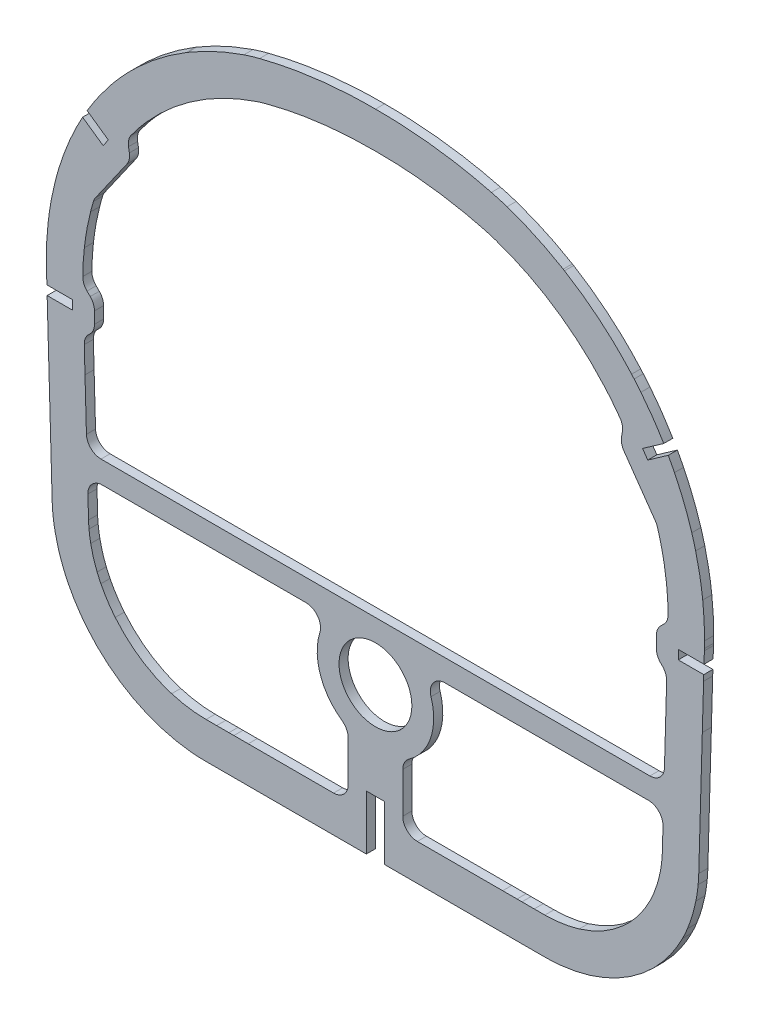
from build123d import *

# Parameters (mm, degrees)
SKETCH1_R           = 12.700000000000001
BOSS_EXTRUDE1_DEPTH = 1.5875
SKETCH2_R           = 20.320000000000004
CUT_EXTRUDE1_DEPTH  = 169.34386796933504
BOSS_EXTRUDE2_START = -3.175
BOSS_EXTRUDE2_DEPTH = 3.175
CUT_EXTRUDE3_DEPTH  = 169.34386796933504
FILLET1_R           = 5.08


with BuildPart() as part:
    # Sketch1 → Boss-Extrude1 (new, symmetric)
    with BuildSketch(Plane.XY):
        with BuildLine():
            Line((-114.7452197006329, 17.502683519570404), (-114.72594109896555, 16.83199064857102))
            add(Edge.make_bspline(
                [(-114.72594109896555, 16.83199064857102), (-114.63641058990241, 13.717126836218588), (-114.54692036583873, 10.602259401409691), (-114.45747777614487, 7.487385264694304)],
                knots=[0, 0, 0, 0, 1, 1, 1, 1], degree=3, weights=[1, 1, 1, 1]))
            add(Edge.make_bspline(
                [(-114.45747777614487, 7.487385264694304), (-114.30718797143473, 2.253479661651684), (-114.15700866213814, -2.980453956785725), (-114.00699685839271, -8.214429233663035)],
                knots=[0, 0, 0, 0, 1, 1, 1, 1], degree=3, weights=[1, 1, 1, 1]))
            add(Edge.make_bspline(
                [(-114.00699685839271, -8.214429233663035), (-113.594092007642, -22.620853681126103), (-113.18138690950695, -37.02768380672695), (-112.76874515326054, -51.434848977248656)],
                knots=[0, 0, 0, 0, 1, 1, 1, 1], degree=3, weights=[1, 1, 1, 1]))
            ThreePointArc((-112.76874515326054, -51.434848977248656), (-112.68804333866615, -53.1759331373922), (-112.55087678962421, -54.91348088447918))
            ThreePointArc((-112.55087678962421, -54.91348088447918), (-112.22797864595222, -57.58878393541259), (-111.77128477130692, -60.244521183405745))
            add(Edge.make_bspline(
                [(-111.77128477130692, -60.244521183405745), (-111.1073733148537, -63.598835081976574), (-110.12206449281399, -66.88944897002129), (-108.83322390889208, -70.0566544796016)],
                knots=[0, 0, 0, 0, 1, 1, 1, 1], degree=3, weights=[1, 1, 1, 1]))
            ThreePointArc((-108.83322390889208, -70.0566544796016), (-108.01356493798, -71.96435471079279), (-107.12076116778223, -73.83893797877646))
            add(Edge.make_bspline(
                [(-107.12076116778223, -73.83893797877646), (-105.32883254477298, -77.42121554975256), (-103.13441882445123, -80.80203517755982), (-100.59192102351365, -83.8972820272281)],
                knots=[0, 0, 0, 0, 1, 1, 1, 1], degree=3, weights=[1, 1, 1, 1]))
            add(Edge.make_bspline(
                [(-100.59192102351365, -83.8972820272281), (-95.59242527238186, -89.98368785895089), (-89.40102010512265, -95.0940325478926), (-82.31665423774274, -98.86998494857941), (-74.78459324955335, -101.17197690928097)],
                knots=[0, 0, 0, 0, 0, 1, 1, 1, 1, 1], degree=4, weights=[1, 1, 1, 1, 1]))
            add(Edge.make_bspline(
                [(-74.78459324955335, -101.17197690928097), (-69.70375314313806, -102.72481259724978), (-64.39158382619704, -103.51812327161942), (-59.07890091428872, -103.51750007032157)],
                knots=[0, 0, 0, 0, 1, 1, 1, 1], degree=3, weights=[1, 1, 1, 1]))
            add(Edge.make_bspline(
                [(-59.07890091428872, -103.51750007032157), (-57.846433259477166, -103.51735549787801), (-56.61397530630568, -103.51723826558838), (-55.38152448537701, -103.517145846477)],
                knots=[0, 0, 0, 0, 1, 1, 1, 1], degree=3, weights=[1, 1, 1, 1]))
            add(Edge.make_bspline(
                [(-55.38152448537701, -103.517145846477), (-53.95716671470069, -103.51703903855777), (-52.53281923226491, -103.51696799755912), (-51.10847777162478, -103.5169356729528)],
                knots=[0, 0, 0, 0, 1, 1, 1, 1], degree=3, weights=[1, 1, 1, 1]))
            Line((-51.10847777162478, -103.5169356729528), (-49.37860046686426, -103.51691546671823))
            add(Edge.make_bspline(
                [(-49.37860046686426, -103.51691546671823), (-47.71016069532774, -103.5169146296126), (-46.04172764724473, -103.51696183124892), (-44.37329370146884, -103.51707762925778)],
                knots=[0, 0, 0, 0, 1, 1, 1, 1], degree=3, weights=[1, 1, 1, 1]))
            add(Edge.make_bspline(
                [(-44.37329370146884, -103.51707762925778), (-29.582422277033825, -103.51810415951752), (-14.791380965373275, -103.51962644471186), (-1.5811525e-09, -103.52167238588633)],
                knots=[0, 0, 0, 0, 1, 1, 1, 1], degree=3, weights=[1, 1, 1, 1]))
            add(Edge.make_bspline(
                [(44.37329370146884, -103.51707762925778), (29.582422277033825, -103.51810415951752), (14.791380965373275, -103.51962644471186), (-1.5811525e-09, -103.52167238588633)],
                knots=[0, 0, 0, 0, 1, 1, 1, 1], degree=3, weights=[1, 1, 1, 1]))
            add(Edge.make_bspline(
                [(49.37860046686426, -103.51691546671823), (47.71016069532774, -103.5169146296126), (46.04172764724473, -103.51696183124892), (44.37329370146884, -103.51707762925778)],
                knots=[0, 0, 0, 0, 1, 1, 1, 1], degree=3, weights=[1, 1, 1, 1]))
            Line((49.37860046686426, -103.51691546671823), (51.10847777162478, -103.5169356729528))
            add(Edge.make_bspline(
                [(55.38152448537701, -103.517145846477), (53.95716671470069, -103.51703903855777), (52.53281923226491, -103.51696799755912), (51.10847777162478, -103.5169356729528)],
                knots=[0, 0, 0, 0, 1, 1, 1, 1], degree=3, weights=[1, 1, 1, 1]))
            add(Edge.make_bspline(
                [(59.07890091428872, -103.51750007032157), (57.846433259477166, -103.51735549787801), (56.61397530630568, -103.51723826558838), (55.38152448537701, -103.517145846477)],
                knots=[0, 0, 0, 0, 1, 1, 1, 1], degree=3, weights=[1, 1, 1, 1]))
            add(Edge.make_bspline(
                [(74.78459324955335, -101.17197690928097), (69.70375314313806, -102.72481259724978), (64.39158382619704, -103.51812327161942), (59.07890091428872, -103.51750007032157)],
                knots=[0, 0, 0, 0, 1, 1, 1, 1], degree=3, weights=[1, 1, 1, 1]))
            add(Edge.make_bspline(
                [(100.59192102351365, -83.8972820272281), (95.59242527238186, -89.98368785895089), (89.40102010512265, -95.0940325478926), (82.31665423774274, -98.86998494857941), (74.78459324955335, -101.17197690928097)],
                knots=[0, 0, 0, 0, 0, 1, 1, 1, 1, 1], degree=4, weights=[1, 1, 1, 1, 1]))
            add(Edge.make_bspline(
                [(107.12076116778223, -73.83893797877646), (105.32883254477298, -77.42121554975256), (103.13441882445123, -80.80203517755982), (100.59192102351365, -83.8972820272281)],
                knots=[0, 0, 0, 0, 1, 1, 1, 1], degree=3, weights=[1, 1, 1, 1]))
            ThreePointArc((107.12076116778223, -73.83893797877646), (108.01356493798, -71.9643547107928), (108.83322390889208, -70.0566544796016))
            add(Edge.make_bspline(
                [(111.77128477130692, -60.244521183405745), (111.1073733148537, -63.598835081976574), (110.12206449281399, -66.88944897002129), (108.83322390889208, -70.0566544796016)],
                knots=[0, 0, 0, 0, 1, 1, 1, 1], degree=3, weights=[1, 1, 1, 1]))
            ThreePointArc((111.77128477130692, -60.244521183405745), (112.22797864595222, -57.58878393541259), (112.55087678962421, -54.91348088447918))
            ThreePointArc((112.55087678962421, -54.91348088447918), (112.68804333866615, -53.17593313739219), (112.76874515326054, -51.434848977248656))
            add(Edge.make_bspline(
                [(114.00699685839271, -8.214429233663035), (113.594092007642, -22.620853681126103), (113.18138690950695, -37.02768380672695), (112.76874515326054, -51.434848977248656)],
                knots=[0, 0, 0, 0, 1, 1, 1, 1], degree=3, weights=[1, 1, 1, 1]))
            add(Edge.make_bspline(
                [(114.45747777614487, 7.487385264694304), (114.30718797143473, 2.253479661651684), (114.15700866213814, -2.980453956785725), (114.00699685839271, -8.214429233663035)],
                knots=[0, 0, 0, 0, 1, 1, 1, 1], degree=3, weights=[1, 1, 1, 1]))
            add(Edge.make_bspline(
                [(114.72594109896555, 16.83199064857102), (114.63641058990241, 13.717126836218588), (114.54692036583873, 10.602259401409691), (114.45747777614487, 7.487385264694304)],
                knots=[0, 0, 0, 0, 1, 1, 1, 1], degree=3, weights=[1, 1, 1, 1]))
            Line((114.72594109896555, 16.83199064857102), (114.7452197006329, 17.502683519570404))
            add(Edge.make_bspline(
                [(114.7890059115134, 19.863219176694063), (114.7835780692486, 19.076239431927775), (114.76783208153577, 18.289356898186814), (114.7452197006329, 17.502683519570404)],
                knots=[0, 0, 0, 0, 0.9999498505076996, 0.9999498505076996, 0.9999498505076996, 0.9999498505076996], degree=3, weights=[1, 1, 1, 1]))
            add(Edge.make_bspline(
                [(114.15894327556961, 31.865695052286362), (114.60613845908075, 27.882027971749473), (114.81665344143374, 23.871808144028062), (114.7890059115134, 19.863219176694063)],
                knots=[0, 0, 0, 0, 1, 1, 1, 1], degree=3, weights=[1, 1, 1, 1]))
            add(Edge.make_bspline(
                [(111.684573502519, 45.4610336377593), (112.81734049393746, 40.992572366905875), (113.64469045396903, 36.44671950470451), (114.15894327556961, 31.865695052286362)],
                knots=[0, 0, 0, 0, 1, 1, 1, 1], degree=3, weights=[1, 1, 1, 1]))
            ThreePointArc((111.684573502519, 45.4610336377593), (111.03906135213371, 47.88139437458557), (110.3339195986165, 50.28505972985278))
            add(Edge.make_bspline(
                [(104.30641025218718, 65.4477511057322), (106.71886285229947, 60.56649996133052), (108.73674389160301, 55.49036874894405), (110.3339195986165, 50.28505972985278)],
                knots=[0, 0, 0, 0, 1, 1, 1, 1], degree=3, weights=[1, 1, 1, 1]))
            add(Edge.make_bspline(
                [(92.59150342724206, 83.84885261225975), (97.14327095044497, 78.16017149746612), (101.07854504066823, 71.97887259239612), (104.30641025218718, 65.4477511057322)],
                knots=[0.00015516687657362, 0.00015516687657362, 0.00015516687657362, 0.00015516687657362, 1, 1, 1, 1], degree=3, weights=[1, 1, 1, 1]))
            ThreePointArc((92.59150342724206, 83.84885261225975), (91.42507816905498, 85.2796957156788), (90.23277102888983, 86.6890443428995))
            ThreePointArc((90.23277102888983, 86.6890443428995), (89.79223213194632, 87.19683786942522), (89.34833219659208, 87.70169590196916))
            add(Edge.make_bspline(
                [(65.94432999771517, 107.22681485913718), (74.66889148105416, 101.94541730184362), (82.58894175346335, 95.33803001789981), (89.34833219659208, 87.70169590196916)],
                knots=[0, 0, 0, 0, 1, 1, 1, 1], degree=3, weights=[1, 1, 1, 1]))
            Line((65.94432999771517, 107.22681485913718), (65.49624085564622, 107.49648616368657))
            add(Edge.make_bspline(
                [(45.895792552675076, 116.5445185858013), (52.726322535675486, 114.23712446443145), (59.3094251803046, 111.19813338148634), (65.49624085564622, 107.49648616368657)],
                knots=[0, 0, 0, 0, 1, 1, 1, 1], degree=3, weights=[1, 1, 1, 1]))
            ThreePointArc((45.895792552675076, 116.5445185858013), (43.17799654744927, 117.40316616219629), (40.42839902855836, 118.1537687671607))
            add(Edge.make_bspline(
                [(40.42839902855836, 118.1537687671607), (39.33806183749876, 118.42838758689368), (37.1574632082568, 118.97760614678802), (33.85630153491988, 119.7094898902904), (30.535885824062376, 120.37426223953587), (27.19582924530948, 120.96549094489052), (23.838631119796016, 121.48509536527982), (20.465916690485443, 121.93269365848225), (17.079460248796543, 122.30850094608213), (13.680927413418125, 122.6123574228248), (10.271955070812115, 122.84468791805438), (6.8541610765224625, 123.00360566536389), (3.429096591574733, 123.09552645722273), (1.143477199439534, 123.09552645720133), (-1.58115076e-09, 123.09552645719057)],
                knots=[0, 0, 0, 0, 0.08319982321872643, 0.16639386599995798, 0.24958922098778757, 0.3327940500648784, 0.41601744163079, 0.49926927384300424, 0.5825600915037497, 0.6659009868953494, 0.7493034844056105, 0.8327794289788419, 0.9163408784672036, 1, 1, 1, 1], degree=3))
            add(Edge.make_bspline(
                [(-40.42839902855836, 118.1537687671607), (-39.33806183758537, 118.42838758688279), (-37.157463208516646, 118.97760614675535), (-33.85630153544102, 119.7094898902324), (-30.535885824845685, 120.37426223945792), (-27.19582924635577, 120.96549094479849), (-23.838631121105937, 121.48509536517938), (-20.465916692059512, 121.93269365837907), (-17.079460250635144, 122.30850094598189), (-13.680927415521507, 122.61235742273314), (-10.27195507318041, 122.84468791797694), (-6.854161079155658, 123.00360566530641), (-3.4290965944727594, 123.09552645719042), (-1.1434772025137092, 123.09552645719056), (-1.58115076e-09, 123.09552645719057)],
                knots=[0, 0, 0, 0, 0.08319982321872643, 0.16639386599995798, 0.24958922098778757, 0.3327940500648784, 0.41601744163079, 0.49926927384300424, 0.5825600915037497, 0.6659009868953494, 0.7493034844056105, 0.8327794289788419, 0.9163408784672036, 1, 1, 1, 1], degree=3))
            ThreePointArc((-40.42839902855836, 118.1537687671607), (-43.17799654744926, 117.4031661621963), (-45.895792552675076, 116.5445185858013))
            add(Edge.make_bspline(
                [(-45.895792552675076, 116.5445185858013), (-52.726322535675486, 114.23712446443145), (-59.3094251803046, 111.19813338148634), (-65.49624085564622, 107.49648616368657)],
                knots=[0, 0, 0, 0, 1, 1, 1, 1], degree=3, weights=[1, 1, 1, 1]))
            Line((-65.49624085564622, 107.49648616368657), (-65.94432999771517, 107.22681485913718))
            add(Edge.make_bspline(
                [(-65.94432999771517, 107.22681485913718), (-74.66889148105416, 101.94541730184362), (-82.58894175346335, 95.33803001789981), (-89.34833219659208, 87.70169590196916)],
                knots=[0, 0, 0, 0, 1, 1, 1, 1], degree=3, weights=[1, 1, 1, 1]))
            ThreePointArc((-89.34833219659208, 87.70169590196916), (-89.79223213194632, 87.19683786942522), (-90.23277102888983, 86.6890443428995))
            ThreePointArc((-90.23277102888983, 86.6890443428995), (-91.42507816905497, 85.27969571567883), (-92.59150342724206, 83.84885261225975))
            add(Edge.make_bspline(
                [(-92.59150342724206, 83.84885261225975), (-97.14327095044497, 78.16017149746612), (-101.07854504066823, 71.97887259239612), (-104.30641025218718, 65.4477511057322)],
                knots=[0.00015516687657362, 0.00015516687657362, 0.00015516687657362, 0.00015516687657362, 1, 1, 1, 1], degree=3, weights=[1, 1, 1, 1]))
            add(Edge.make_bspline(
                [(-104.30641025218718, 65.4477511057322), (-106.71886285229947, 60.56649996133052), (-108.73674389160301, 55.49036874894405), (-110.3339195986165, 50.28505972985278)],
                knots=[0, 0, 0, 0, 1, 1, 1, 1], degree=3, weights=[1, 1, 1, 1]))
            ThreePointArc((-110.3339195986165, 50.28505972985278), (-111.03906135213371, 47.881394374585554), (-111.684573502519, 45.4610336377593))
            add(Edge.make_bspline(
                [(-111.684573502519, 45.4610336377593), (-112.81734049393746, 40.992572366905875), (-113.64469045396903, 36.44671950470451), (-114.15894327556961, 31.865695052286362)],
                knots=[0, 0, 0, 0, 1, 1, 1, 1], degree=3, weights=[1, 1, 1, 1]))
            add(Edge.make_bspline(
                [(-114.15894327556961, 31.865695052286362), (-114.60613845908075, 27.882027971749473), (-114.81665344143374, 23.871808144028062), (-114.7890059115134, 19.863219176694063)],
                knots=[0, 0, 0, 0, 1, 1, 1, 1], degree=3, weights=[1, 1, 1, 1]))
            add(Edge.make_bspline(
                [(-114.7890059115134, 19.863219176694063), (-114.7835780692486, 19.076239431927775), (-114.76783208153577, 18.289356898186814), (-114.7452197006329, 17.502683519570404)],
                knots=[0, 0, 0, 0, 0.9999498505076996, 0.9999498505076996, 0.9999498505076996, 0.9999498505076996], degree=3, weights=[1, 1, 1, 1]))
        make_face()
        with Locations((0, -50.8)):
            Circle(SKETCH1_R, mode=Mode.SUBTRACT)
    extrude(amount=BOSS_EXTRUDE1_DEPTH, both=True)

    # Sketch2 → Cut-Extrude1 (cut, through all)
    with BuildSketch(Plane.XY.offset(1.5875)):
        with BuildLine():
            Line((-102.05046304501089, 17.867585498929238), (-102.03118420379151, 17.19688429403577))
            add(Edge.make_bspline(
                [(-102.03118420379151, 17.19688429403577), (-102.00880074568765, 16.41813943518699), (-101.96403890957323, 14.860650807524046), (-101.89691177324582, 12.524410000891692), (-101.82980105137004, 10.18816478438498), (-101.78507189346547, 8.630662089436115), (-101.76271032129195, 7.851911350464416)],
                knots=[-8.9129106647e-07, -8.9129106647e-07, -8.9129106647e-07, -8.9129106647e-07, 0.24999933153170015, 0.49999955435446675, 0.7499997771772333, 1, 1, 1, 1], degree=3))
            add(Edge.make_bspline(
                [(-101.76271032129195, 7.851911350464416), (-101.72513644418133, 6.543385290985036), (-101.65000280099126, 3.926340070305929), (-101.53734822694257, 0.00072939642337794), (-101.42474548905955, -3.9249044925446195), (-101.34971468786911, -6.542025090419771), (-101.31220993120635, -7.850581912197028)],
                knots=[0, 0, 0, 0, 0.25, 0.5, 0.75, 1, 1, 1, 1], degree=3))
            add(Edge.make_bspline(
                [(-101.31220993120635, -7.850581912197028), (-101.20900572823022, -11.451420095940556), (-101.00262463643593, -18.6530649395015), (-100.69311365187139, -29.45572791211675), (-100.38365329188234, -40.25848396259931), (-100.17736995172882, -47.4604370312094), (-100.07423324793606, -51.0613993294313)],
                knots=[0, 0, 0, 0, 0.2499430109272707, 0.4998860218545414, 0.7498290327818121, 0.9997720437090828, 0.9997720437090828, 0.9997720437090828, 0.9997720437090828], degree=3))
            ThreePointArc((-100.07423324793606, -51.0613993294313), (-100.01261182717461, -52.38633841552202), (-99.90816190893503, -53.70859065920598))
            ThreePointArc((-99.90816190893503, -53.70859065920598), (-99.66163291628735, -55.75113462094698), (-99.31295711405238, -57.77874098432134))
            add(Edge.make_bspline(
                [(-99.31295711405238, -57.77874098432134), (-99.18629820756037, -58.41866084206956), (-98.90236460900753, -59.692255532014435), (-98.38522585746843, -61.58227401578457), (-97.77853202516384, -63.4454753308098), (-97.31578928202734, -64.66552433544275), (-97.0699125288233, -65.26974468553459)],
                knots=[8.43480030505e-06, 8.43480030505e-06, 8.43480030505e-06, 8.43480030505e-06, 0.2500054480585301, 0.5000024613167552, 0.7499994745749803, 0.9999964878332054, 0.9999964878332054, 0.9999964878332054, 0.9999964878332054], degree=3))
            ThreePointArc((-97.0699125288233, -65.26974468553459), (-96.44413848330768, -66.72618981171381), (-95.76252267250297, -68.15735208346123))
            add(Edge.make_bspline(
                [(-95.76252267250297, -68.15735208346123), (-95.42072188376622, -68.84065093508114), (-94.69887081665928, -70.1877942842476), (-93.50307408806886, -72.14785264783423), (-92.19969597359791, -74.0380529132366), (-91.26318901742911, -75.24578261555591), (-90.77825654130869, -75.83614132440513)],
                knots=[3.67711913523e-06, 3.67711913523e-06, 3.67711913523e-06, 3.67711913523e-06, 0.2500027578393514, 0.5000018385595676, 0.7500009192797839, 1, 1, 1, 1], degree=3))
            add(Edge.make_bspline(
                [(-90.77825654130869, -75.83614132440513), (-89.5068666996648, -77.38393632849585), (-86.73246204698775, -80.2974199077113), (-81.9810924504027, -84.00890073067299), (-76.73882276751849, -86.98682408691383), (-72.98807379122894, -88.44114372697547), (-71.0726378596952, -89.02655031390347)],
                knots=[0, 0, 0, 0, 0.25, 0.5, 0.75, 1, 1, 1, 1], degree=3))
            add(Edge.make_bspline(
                [(-71.0726378596952, -89.02655031390347), (-70.10382176731555, -89.32264548159553), (-68.14473406941967, -89.84228531511037), (-65.14840486386493, -90.40375090675532), (-62.11878846703002, -90.74220704745068), (-60.09341988424078, -90.81761899052385), (-59.080390680675904, -90.81750015769968)],
                knots=[0, 0, 0, 0, 0.25, 0.5, 0.75, 1, 1, 1, 1], degree=3))
            add(Edge.make_bspline(
                [(-59.080390680675904, -90.81750015769968), (-58.77222793445742, -90.81746400921249), (-58.155900800659786, -90.81739512994476), (-57.23142012830801, -90.81730182892072), (-56.30694426326282, -90.81721830822251), (-55.690633155068674, -90.81716899023291), (-55.38247683389354, -90.81714588218439)],
                knots=[0, 0, 0, 0, 0.25, 0.5, 0.75, 1, 1, 1, 1], degree=3))
            add(Edge.make_bspline(
                [(-55.38247683389354, -90.81714588218439), (-55.026328467618264, -90.81711917578609), (-54.31403171190898, -90.81707023455843), (-53.24558692028407, -90.81701051424052), (-52.17714195004347, -90.81696476177872), (-51.46484462999912, -90.81694375722223), (-51.10869605403507, -90.81693567463611)],
                knots=[0, 0, 0, 0, 0.2500040917593769, 0.5000081835187538, 0.7500122752781306, 1.0000163670375075, 1.0000163670375075, 1.0000163670375075, 1.0000163670375075], degree=3))
            Line((-51.10869605403507, -90.81693567463611), (-49.37867782580123, -90.81691546675545))
            add(Edge.make_bspline(
                [(-49.37867782580123, -90.81691546675545), (-48.96149814615948, -90.81691525744405), (-48.127143203246426, -90.81692084348609), (-46.87558429083459, -90.81694916933752), (-45.62401153224609, -90.81699936889878), (-44.7896104068153, -90.81704870412081), (-44.37241225530023, -90.81707765984626)],
                knots=[-1.418230617083e-05, -1.418230617083e-05, -1.418230617083e-05, -1.418230617083e-05, 0.24998936327037188, 0.4999929088469146, 0.7499964544234573, 1, 1, 1, 1], degree=3))
            add(Edge.make_bspline(
                [(-44.37241225530023, -90.81707765984626), (-40.67475786507488, -90.81733428800648), (-33.5817552245195, -90.8178859946959), (-24.63983871217231, -90.81872725376154), (-17.244432865936744, -90.81951326702921), (-9.546700393673413, -90.82040355381663), (-3.697752930631585, -90.82116080223688), (-1.060272e-11, -90.82167226439844)],
                knots=[0, 0, 0, 0, 0.2499901033324907, 0.4795432670368797, 0.604538318703125, 0.749970309997472, 0.9999604133299628, 0.9999604133299628, 0.9999604133299628, 0.9999604133299628], degree=3))
            add(Edge.make_bspline(
                [(-1.060272e-11, -90.82167226439844), (3.697752930609162, -90.82116080223688), (9.54670039365822, -90.8204035538166), (17.244432865929777, -90.8195132670292), (24.63983871216943, -90.81872725376152), (33.58175522451756, -90.81788599469587), (40.67475786507284, -90.81733428800648), (44.372412283877324, -90.81707765984429)],
                knots=[3.958666948614e-05, 3.958666948614e-05, 3.958666948614e-05, 3.958666948614e-05, 0.2500296900021146, 0.3954616812968122, 0.5204567329631264, 0.7500098966673716, 1, 1, 1, 1], degree=3))
            add(Edge.make_bspline(
                [(44.372412283877324, -90.81707765984429), (44.78961040671183, -90.81704870412082), (45.624011531935736, -90.8169993688988), (46.87558429021371, -90.81694916933753), (48.127143202315146, -90.81692084348612), (48.96149814502146, -90.81691525744405), (49.378677824559816, -90.81691546675545)],
                knots=[0, 0, 0, 0, 0.2500035455145379, 0.5000070910290758, 0.7500106365436137, 1.0000141820581516, 1.0000141820581516, 1.0000141820581516, 1.0000141820581516], degree=3))
            Line((49.378677824559816, -90.81691546675545), (51.108696054035065, -90.81693567463611))
            add(Edge.make_bspline(
                [(51.108696054035065, -90.81693567463611), (51.46484462999911, -90.81694375722223), (52.177141950043456, -90.81696476177869), (53.245586920284026, -90.81701051424054), (54.3140317119089, -90.81707023455843), (55.02632846761824, -90.81711917578609), (55.38247681673545, -90.81714588218311)],
                knots=[-1.636703750918e-05, -1.636703750918e-05, -1.636703750918e-05, -1.636703750918e-05, 0.24998772472186812, 0.4999918164812454, 0.7499959082406227, 1, 1, 1, 1], degree=3))
            add(Edge.make_bspline(
                [(55.38247681673545, -90.81714588218311), (55.69063315506869, -90.81716899023291), (56.30694426326287, -90.8172183082225), (57.23142012830801, -90.81730182892075), (58.155900800659744, -90.8173951299447), (58.772227934457405, -90.81746400921249), (59.08039066536946, -90.81750015769789)],
                knots=[0, 0, 0, 0, 0.25, 0.5, 0.75, 1, 1, 1, 1], degree=3))
            add(Edge.make_bspline(
                [(59.08039066536946, -90.81750015769789), (60.09341988424078, -90.81761899052385), (62.11878846703002, -90.7422070474507), (65.14840486386494, -90.4037509067553), (68.14473406941966, -89.84228531511037), (70.10382176731555, -89.32264548159553), (71.07263785161442, -89.02655031637316)],
                knots=[0, 0, 0, 0, 0.25, 0.5, 0.75, 1, 1, 1, 1], degree=3))
            add(Edge.make_bspline(
                [(71.07263785161442, -89.02655031637316), (72.98807379122894, -88.44114372697547), (76.73882276751851, -86.98682408691383), (81.98109245040266, -84.00890073067303), (86.73246204698773, -80.29741990771124), (89.5068666996648, -77.38393632849585), (90.77825654919137, -75.83614131480874)],
                knots=[0, 0, 0, 0, 0.25, 0.5, 0.75, 1, 1, 1, 1], degree=3))
            add(Edge.make_bspline(
                [(90.77825654919137, -75.83614131480874), (91.2631890173243, -75.24578261568351), (92.19969597329778, -74.03805291363123), (93.50307408752082, -72.14785264866154), (94.69887081591197, -70.1877942855346), (95.42072188292087, -68.84065093668812), (95.76252267161738, -68.15735208523164)],
                knots=[0, 0, 0, 0, 0.24999908066620047, 0.49999816133240094, 0.7499972419986014, 0.9999963226648019, 0.9999963226648019, 0.9999963226648019, 0.9999963226648019], degree=3))
            ThreePointArc((95.76252267161738, -68.15735208523164), (96.44413848264907, -66.72618981316852), (97.06991252836568, -65.26974468665921))
            add(Edge.make_bspline(
                [(97.06991252836568, -65.26974468665921), (97.31578926594958, -64.66552437500391), (97.77853198152432, -63.44547544874921), (98.38522578373491, -61.582274255118016), (98.90236451677828, -59.69225589547733), (99.1862981109365, -58.41866128920468), (99.31295701722328, -57.7787414735317)],
                knots=[3.51201162711e-06, 3.51201162711e-06, 3.51201162711e-06, 3.51201162711e-06, 0.2500005093742845, 0.4999975067369418, 0.7499945040995992, 0.9999915014622566, 0.9999915014622566, 0.9999915014622566, 0.9999915014622566], degree=3))
            ThreePointArc((99.31295701722328, -57.7787414735317), (99.66163293864912, -55.75113446798273), (99.90816198558139, -53.70858985496883))
            ThreePointArc((99.90816198558139, -53.70858985496883), (100.0126118523438, -52.38633801443182), (100.07423324781801, -51.061399333552586))
            add(Edge.make_bspline(
                [(100.07423324781801, -51.061399333552586), (100.1773699516206, -47.46043703498724), (100.3836532917938, -40.2584839656902), (100.69311365181237, -29.45572791417735), (101.0026246364064, -18.653064940531777), (101.20900572822039, -11.451420096283982), (101.31220993151321, -7.850581901490445)],
                knots=[0.00022795619556494, 0.00022795619556494, 0.00022795619556494, 0.00022795619556494, 0.2501709671466737, 0.5001139780977825, 0.7500569890488913, 1, 1, 1, 1], degree=3))
            add(Edge.make_bspline(
                [(101.31220993151321, -7.850581901490445), (101.34971468786911, -6.542025090419769), (101.42474548905955, -3.9249044925446057), (101.53734822694258, 0.00072939642335994), (101.65000280099126, 3.9263400703059212), (101.72513644418133, 6.543385290985033), (101.76271031580394, 7.851911159342872)],
                knots=[0, 0, 0, 0, 0.25, 0.5, 0.75, 1, 1, 1, 1], degree=3))
            add(Edge.make_bspline(
                [(101.76271031580394, 7.851911159342872), (101.78507189346567, 8.63066208944247), (101.82980105137051, 10.188164784404048), (101.89691177324696, 12.524410000929816), (101.96403890957487, 14.86065080758139), (102.00880074568964, 16.418139435256986), (102.0311842037937, 17.19688429411211)],
                knots=[0, 0, 0, 0, 0.2500002228248089, 0.5000004456496178, 0.7500006684744267, 1.0000008912992355, 1.0000008912992355, 1.0000008912992355, 1.0000008912992355], degree=3))
            Line((102.0311842037937, 17.19688429411211), (102.05046304501089, 17.867585498929238))
            add(Edge.make_bspline(
                [(102.05046304501089, 17.867585498929238), (102.05555198514352, 18.044627171140018), (102.0650008891123, 18.40047180154699), (102.07631905368208, 18.92387061955839), (102.08469204339556, 19.442100282331676), (102.0881344197804, 19.78065786474588), (102.08930796618628, 19.95080968676288)],
                knots=[0, 0, 0, 0, 0.2499874626269249, 0.4999749252538498, 0.7499623878807746, 0.9999498505076996, 0.9999498505076996, 0.9999498505076996, 0.9999498505076996], degree=3))
            add(Edge.make_bspline(
                [(102.08930796618628, 19.95080968676288), (102.09535292384417, 20.827262326300833), (102.08140729892692, 22.580361418828584), (101.98248437874895, 25.20872118348459), (101.80567327412868, 27.832993934594363), (101.63599195959017, 29.577923302578082), (101.53821545127961, 30.448927892449515)],
                knots=[0, 0, 0, 0, 0.25, 0.5, 0.75, 1, 1, 1, 1], degree=3))
            add(Edge.make_bspline(
                [(101.53821545127961, 30.448927892449515), (101.42578092909513, 31.45050780370795), (101.16668301096348, 33.449848275612155), (100.67586695416037, 36.43458947012108), (100.08359076333828, 39.40086501355609), (99.62164268863994, 41.36328732806594), (99.37397869964666, 42.340255593812515)],
                knots=[0, 0, 0, 0, 0.2499998188868767, 0.4999996377737534, 0.7499994566606301, 0.9999992755475068, 0.9999992755475068, 0.9999992755475068, 0.9999992755475068], degree=3))
            ThreePointArc((99.37397869964666, 42.340255593812515), (98.80937085295291, 44.45726378503892), (98.19260726681969, 46.55966916485713))
            add(Edge.make_bspline(
                [(98.19260726681969, 46.55966916485713), (97.84345566195333, 47.697579032794856), (97.09915665992513, 49.95932486106072), (95.84647491920826, 53.30533976886939), (94.46005372829133, 56.59819957707514), (93.44839933390465, 58.75369615598407), (92.92102148983902, 59.820769434338864)],
                knots=[0, 0, 0, 0, 0.25, 0.5, 0.75, 1, 1, 1, 1], degree=3))
            add(Edge.make_bspline(
                [(92.92102148983902, 59.820769434338864), (92.21548803284107, 61.2483150158941), (90.72707584657853, 64.06526178809665), (88.26847470328808, 68.16681609260584), (85.59263785173759, 72.13014281908018), (83.67007988477111, 74.6709374256886), (82.67516909110866, 75.91435115759849)],
                knots=[0.00015516687657362, 0.00015516687657362, 0.00015516687657362, 0.00015516687657362, 0.2501163751574302, 0.5000775834382868, 0.7500387917191433, 1, 1, 1, 1], degree=3))
            ThreePointArc((82.67516909110866, 75.91435115759849), (81.65498846378713, 77.16579732154631), (80.61217098558929, 78.39844395411646))
            ThreePointArc((80.61217098558929, 78.39844395411646), (80.22687625477269, 78.84255939544417), (79.83864206896111, 79.2841075491901))
            add(Edge.make_bspline(
                [(79.83864206896111, 79.2841075491901), (78.362419755589, 80.95184993761991), (75.28311452737069, 84.17530614283795), (70.30738583476118, 88.65469182548489), (65.00932069546128, 92.74790914252326), (61.2863322048114, 95.20037670594242), (59.38111355926563, 96.3541667315568)],
                knots=[7.0229520058e-07, 7.0229520058e-07, 7.0229520058e-07, 7.0229520058e-07, 0.24985235307812562, 0.4997040038610506, 0.7495556546439757, 0.9994073054269007, 0.9994073054269007, 0.9994073054269007, 0.9994073054269007], degree=3))
            Line((59.38111355926563, 96.3541667315568), (58.962072488487195, 96.60635617693106))
            add(Edge.make_bspline(
                [(58.962072488487195, 96.60635617693106), (57.6105887967087, 97.41463586120183), (54.86430448145778, 98.95894080249835), (50.62489881658705, 101.0540472759125), (46.280089057031745, 102.92071293409039), (43.32319375186885, 104.00851148615602), (41.8312984434788, 104.51248269671301)],
                knots=[0.0008382597391761, 0.0008382597391761, 0.0008382597391761, 0.0008382597391761, 0.25062869480438205, 0.500419129869588, 0.750209564934794, 1, 1, 1, 1], degree=3))
            ThreePointArc((41.8312984434788, 104.51248269671301), (39.5920368262576, 105.21994438476844), (37.32657312697299, 105.8383850510009))
            add(Edge.make_bspline(
                [(37.32657312697299, 105.8383850510009), (36.92530856620725, 105.93944993348103), (36.11119988877999, 106.14447337351622), (34.958304093100374, 106.42983511908851), (33.856064431472966, 106.69300557999736), (32.369380378047225, 107.0311468077866), (30.45622831449002, 107.43939678098556), (27.402681228722333, 108.04166849664509), (23.559199224428657, 108.69958884332928), (18.90630305620638, 109.34205694603185), (14.223403122214032, 109.83515056468693), (10.305878354632908, 110.12247644489572), (7.161744759279607, 110.2765503137651), (5.181542217891477, 110.34430997249517), (3.631808636081472, 110.37767877013877), (2.476199978342701, 110.39092951997526), (1.2687523576716555, 110.3955068589017), (0.41920210030430516, 110.39552645719452), (-1.46176332e-09, 110.39552645719058)],
                knots=[0, 0, 0, 0, 0.03125, 0.0625, 0.09375, 0.125, 0.1875, 0.25, 0.375, 0.5, 0.625, 0.75, 0.8125, 0.875, 0.90625, 0.9375, 0.96875, 1, 1, 1, 1], degree=3))
            add(Edge.make_bspline(
                [(-1.46176332e-09, 110.39552645719058), (-0.4192021033141629, 110.39552645719057), (-1.2687523606152538, 110.39550685888972), (-2.476199981187748, 110.39092951995234), (-3.631808638827716, 110.37767877010603), (-5.181542220505861, 110.34430997245072), (-7.161744761728865, 110.27655031370762), (-10.30587835681764, 110.12247644482147), (-14.22340312406828, 109.8351505645998), (-18.906303057663887, 109.34205694594196), (-23.559199225490087, 108.69958884324934), (-27.40268122945493, 108.04166849658422), (-30.45622831496047, 107.43939678094645), (-32.36938037835426, 107.03114680776355), (-33.856064431649536, 106.6930055799892), (-34.95830409317942, 106.42983511909273), (-36.11119988876163, 106.14447337353303), (-36.92530856612372, 105.93944993350608), (-37.32657312685691, 105.83838505103013)],
                knots=[0, 0, 0, 0, 0.03125, 0.0625, 0.09375, 0.125, 0.1875, 0.25, 0.375, 0.5, 0.625, 0.75, 0.8125, 0.875, 0.90625, 0.9375, 0.96875, 1, 1, 1, 1], degree=3))
            ThreePointArc((-37.32657312685691, 105.83838505103013), (-39.5920368262002, 105.21994438478539), (-41.8312984434788, 104.51248269671301))
            add(Edge.make_bspline(
                [(-41.8312984434788, 104.51248269671301), (-43.32319375186843, 104.00851148615617), (-46.28008905703052, 102.92071293409089), (-50.62489881658459, 101.0540472759136), (-54.86430448145424, 98.95894080250017), (-57.61058879670449, 97.41463586120426), (-58.962072488482654, 96.60635617693379)],
                knots=[0, 0, 0, 0, 0.24979043506513618, 0.49958087013027236, 0.7493713051954085, 0.9991617402605447, 0.9991617402605447, 0.9991617402605447, 0.9991617402605447], degree=3))
            Line((-58.962072488482654, 96.60635617693379), (-59.38111355928136, 96.3541667315473))
            add(Edge.make_bspline(
                [(-59.38111355928136, 96.3541667315473), (-61.286332204825584, 95.2003767059333), (-65.00932069547245, 92.74790914251514), (-70.30738583476817, 88.65469182547885), (-75.28311452737397, 84.1753061428346), (-78.36241975559008, 80.95184993761873), (-79.83864206896118, 79.28410754919005)],
                knots=[0.00059269457378591, 0.00059269457378591, 0.00059269457378591, 0.00059269457378591, 0.25044434535654, 0.5002959961392941, 0.7501476469220483, 0.9999992977048023, 0.9999992977048023, 0.9999992977048023, 0.9999992977048023], degree=3))
            ThreePointArc((-79.83864206896118, 79.28410754919005), (-80.2268763104426, 78.84255944406567), (-80.61217102758923, 78.39844399031013))
            ThreePointArc((-80.61217102758923, 78.39844399031013), (-81.65498850642886, 77.16579735695959), (-82.67516909110864, 75.9143511575985))
            add(Edge.make_bspline(
                [(-82.67516909110864, 75.9143511575985), (-83.6700798847711, 74.67093742568862), (-85.59263785173759, 72.13014281908019), (-88.26847470328806, 68.16681609260584), (-90.72707584657857, 64.06526178809665), (-92.21548803284107, 61.24831501589409), (-92.92102145374395, 59.82076950737208)],
                knots=[0.00015516687657362, 0.00015516687657362, 0.00015516687657362, 0.00015516687657362, 0.2501163751574302, 0.5000775834382868, 0.7500387917191433, 1, 1, 1, 1], degree=3))
            add(Edge.make_bspline(
                [(-92.92102145374395, 59.82076950737208), (-93.44839933390463, 58.75369615598407), (-94.46005372829136, 56.59819957707517), (-95.84647491920826, 53.305339768869416), (-97.09915665992509, 49.95932486106069), (-97.84345566195333, 47.697579032794856), (-98.19260726681969, 46.55966916485713)],
                knots=[0, 0, 0, 0, 0.25, 0.5, 0.75, 1, 1, 1, 1], degree=3))
            ThreePointArc((-98.19260726681969, 46.55966916485713), (-98.80937085296254, 44.45726378504165), (-99.37397869964663, 42.340255593812586))
            add(Edge.make_bspline(
                [(-99.37397869964663, 42.340255593812586), (-99.62164268863991, 41.36328732806597), (-100.08359076333828, 39.40086501355606), (-100.6758669541604, 36.43458947012112), (-101.16668301096352, 33.44984827561212), (-101.42578092909513, 31.450507803707943), (-101.53821544865872, 30.448927915796695)],
                knots=[7.2445249319e-07, 7.2445249319e-07, 7.2445249319e-07, 7.2445249319e-07, 0.2500005433393699, 0.5000003622262466, 0.7500001811131233, 1, 1, 1, 1], degree=3))
            add(Edge.make_bspline(
                [(-101.53821544865872, 30.448927915796695), (-101.63599195959017, 29.577923302578082), (-101.80567327412868, 27.832993934594395), (-101.98248437874894, 25.208721183484517), (-102.08140729892695, 22.580361418828666), (-102.09535292384417, 20.827262326300847), (-102.08930796778053, 19.95080991790993)],
                knots=[0, 0, 0, 0, 0.25, 0.5, 0.75, 1, 1, 1, 1], degree=3))
            add(Edge.make_bspline(
                [(-102.08930796778053, 19.95080991790993), (-102.0881344197804, 19.780657864745837), (-102.08469204339553, 19.44210028233151), (-102.07631905368208, 18.92387061955825), (-102.06500088911237, 18.400471801546818), (-102.05555198514352, 18.044627171139975), (-102.05046304501089, 17.867585498929238)],
                knots=[0, 0, 0, 0, 0.2499874626269249, 0.4999749252538498, 0.7499623878807746, 0.9999498505076996, 0.9999498505076996, 0.9999498505076996, 0.9999498505076996], degree=3))
        make_face()
        with Locations((0, -50.8)):
            Circle(SKETCH2_R, mode=Mode.SUBTRACT)
    extrude(amount=-CUT_EXTRUDE1_DEPTH, mode=Mode.SUBTRACT)


with BuildPart() as cut_extrude1_piece_1:
    # of the separate pieces the step leaves, piece 1, a body of its own (cut_extrude1_pieces)
    add(part.part.solids().sort_by_distance((-110.333919599, 50.28505973, 0))[0])



with BuildPart() as cut_extrude1_piece_2:
    # of the separate pieces the step leaves, piece 2, a body of its own (cut_extrude1_pieces)
    add(part.part.solids().sort_by_distance((20.32, -50.8, -1.5875))[0])


with BuildPart() as cut_extrude1_piece_1_1:
    add(cut_extrude1_piece_1.part)

    add(cut_extrude1_piece_2.part)  # Boss-Extrude2 merges Cut-Extrude1 piece 2
    # Boss-Extrude2: read off the stored shape, not the designer's step
    # Boss-Extrude2 outline → Boss-Extrude2 (add)
    with BuildSketch(Plane.XY.offset(1.5875).offset(BOSS_EXTRUDE2_START)):
        with BuildLine():
            ThreePointArc((9.525, -68.749283412), (0, -71.12), (-9.525, -68.749283412))
            Line((-9.525, -68.749283412), (-9.525, -90.820426895))
            add(Edge.make_bspline(
                [(-9.525, -90.820426895), (-7.408338307330679, -90.82068768198937), (-5.291668853102955, -90.82095906998927), (-3.175, -90.821241139)],
                knots=[0.7853116104343689, 0.7853116104343689, 0.7853116104343689, 0.7853116104343689, 0.9284108391590461, 0.9284108391590461, 0.9284108391590461, 0.9284108391590461], degree=3))
            Line((-3.175, -90.821241139), (-3.175, -84.471241252))
            Line((-3.175, -84.471241252), (3.175, -84.471241252))
            Line((3.175, -84.471241252), (3.175, -90.821241139))
            add(Edge.make_bspline(
                [(3.175, -90.821241139), (5.291668853102947, -90.82095906998926), (7.408338307330671, -90.82068768198937), (9.525, -90.820426895)],
                knots=[0.0715891608409543, 0.0715891608409543, 0.0715891608409543, 0.0715891608409543, 0.2146883895656309, 0.2146883895656309, 0.2146883895656309, 0.2146883895656309], degree=3))
            Line((9.525, -90.820426895), (9.525, -68.749283412))
        make_face()
        with BuildLine():
            ThreePointArc((-98.192607267, 46.559669165), (-98.272344499, 46.298363251), (-98.351275909, 46.036812798))
            ThreePointArc((-98.351275909, 46.036812798), (-98.057254135, 46.791778436), (-97.646947335, 47.490398682))
            Line((-97.646947335, 47.490398682), (-85.467836988, 64.883970848))
            Line((-85.467836988, 64.883970848), (-86.136146904, 68.674144729))
            ThreePointArc((-86.136146904, 68.674144729), (-86.083993433, 70.695253944), (-85.247679039, 72.535955081))
            add(Edge.make_bspline(
                [(-85.247679039, 72.535955081), (-85.35153716666974, 72.39254719704765), (-86.38543422141949, 70.95588922481066), (-88.2684747032881, 68.1668160926058), (-90.7270758465786, 64.0652617880966), (-92.2154880328411, 61.2483150158941), (-92.921021454, 59.820769507)],
                knots=[0.22233052675122122, 0.22233052675122122, 0.22233052675122122, 0.22233052675122122, 0.25011637515743, 0.500077583438287, 0.750038791719143, 1, 1, 1, 1], degree=3))
            add(Edge.make_bspline(
                [(-92.921021454, 59.820769507), (-93.4483993339046, 58.7536961559841), (-94.4600537282914, 56.5981995770752), (-95.8464749192083, 53.3053397688694), (-97.0991566599251, 49.9593248610607), (-97.8434556619533, 47.6975790327949), (-98.192607267, 46.559669165)],
                knots=[0, 0, 0, 0, 0.25, 0.5, 0.75, 1, 1, 1, 1], degree=3))
        make_face()
        with BuildLine():
            add(Edge.make_bspline(
                [(-101.762710316, 7.851911159), (-101.725136444181, 6.54338529098504), (-101.68212428670063, 5.045191454164694), (-101.63912215567348, 3.5469882568067206), (-101.633678253, 3.357315705)],
                knots=[0, 0, 0, 0, 0.25, 0.28623766700362413, 0.28623766700362413, 0.28623766700362413, 0.28623766700362413], degree=3))
            Line((-101.633678253, 3.357315705), (-98.00599396, 6.985))
            Line((-98.00599396, 6.985), (-98.00599396, 15.24))
            Line((-98.00599396, 15.24), (-102.082433427, 19.316439467))
            add(Edge.make_bspline(
                [(-102.082433427, 19.316439467), (-102.08052729922267, 19.18604612992626), (-102.0754098424024, 18.88182492335673), (-102.065000889112, 18.4004718015468), (-102.055551985144, 18.04462717114), (-102.050463045, 17.867585499)],
                knots=[0.3102334731992063, 0.3102334731992063, 0.3102334731992063, 0.3102334731992063, 0.49997492525385, 0.749962387880775, 0.9999498505077, 0.9999498505077, 0.9999498505077, 0.9999498505077], degree=3))
            Line((-102.050463045, 17.867585499), (-102.031184204, 17.196884294))
            add(Edge.make_bspline(
                [(-102.031184204, 17.196884294), (-102.008800745688, 16.418139435187), (-101.964038909573, 14.860650807524), (-101.896911773246, 12.5244100008917), (-101.82980105137, 10.188164784385), (-101.785071893465, 8.63066208943611), (-101.762710316, 7.851911159)],
                knots=[-8.9129106647e-07, -8.9129106647e-07, -8.9129106647e-07, -8.9129106647e-07, 0.2499993315317, 0.499999554354467, 0.749999777177233, 1, 1, 1, 1], degree=3))
        make_face()
        with BuildLine():
            Line((-100.445489659, -38.1), (-15.862294916, -38.1))
            ThreePointArc((-15.862294916, -38.1), (-8.798818102, -32.483799521), (0, -30.48))
            Line((0, -30.48), (-100.66377851, -30.48))
            add(Edge.make_bspline(
                [(-100.66377851, -30.48), (-100.59101177918407, -33.019990079623916), (-100.51824912668849, -35.559988510538034), (-100.445489659, -38.1)],
                knots=[0.5235843046410094, 0.5235843046410094, 0.5235843046410094, 0.5235843046410094, 0.699887914672095, 0.699887914672095, 0.699887914672095, 0.699887914672095], degree=3))
        make_face()
    boss_extrude2 = extrude(amount=BOSS_EXTRUDE2_DEPTH)

    # Sketch4<5> → Cut-Extrude3 (cut, through all)
    with BuildSketch(Plane.XY.offset(1.5875)):
        with BuildLine():
            Line((-105.6259939602015, 12.699999999999987), (-114.60719965430687, 12.699999999999985))
            add(Edge.make_bspline(
                [(-114.60719965430687, 12.699999999999983), (-114.57679263442805, 11.641667282308484), (-114.54639064030326, 10.583333989237563), (-114.51599396020151, 9.524999999999984)],
                knots=[0.4421796592549111, 0.4421796592549111, 0.4421796592549111, 0.4421796592549111, 0.7819477802411181, 0.7819477802411181, 0.7819477802411181, 0.7819477802411181], degree=3))
            Line((-114.5159939602015, 9.524999999999986), (-105.6259939602015, 9.524999999999988))
            Line((-105.6259939602015, 9.524999999999988), (-105.6259939602015, 12.699999999999987))
        make_face()
        with BuildLine():
            add(Edge.make_bspline(
                [(-3.1749999999996037, -90.82124113940093), (-2.1166661679443592, -90.82138217402753), (-1.0583324861701457, -90.82152587900408), (-1.060272e-11, -90.82167226439844)],
                knots=[0.9284108391590554, 0.9284108391590554, 0.9284108391590554, 0.9284108391590554, 0.9999604133299628, 0.9999604133299628, 0.9999604133299628, 0.9999604133299628], degree=3))
            Line((-3.1750000000000003, -90.82124113940091), (-3.1750000000000007, -103.52124125211574))
            add(Edge.make_bspline(
                [(-3.175000000000007, -103.52124125211574), (-2.1166683645910753, -103.52138228932093), (-1.0583350525133932, -103.52152599717101), (-1.5811525e-09, -103.52167238588633)],
                knots=[0.928449206093539, 0.928449206093539, 0.928449206093539, 0.928449206093539, 1, 1, 1, 1], degree=3))
            add(Edge.make_bspline(
                [(3.175000000000007, -103.52124125211574), (2.1166683645910753, -103.52138228932093), (1.0583350525133932, -103.52152599717101), (1.5811525e-09, -103.52167238588633)],
                knots=[0.928449206093539, 0.928449206093539, 0.928449206093539, 0.928449206093539, 1, 1, 1, 1], degree=3))
            Line((3.1750000000000007, -103.52124125211574), (3.1750000000000003, -90.82124113940037))
            add(Edge.make_bspline(
                [(-1.385604e-11, -90.82167226439844), (1.058332474982353, -90.82152587900562), (2.116666145593208, -90.82138217403055), (3.1750000000002006, -90.82124113940037)],
                knots=[3.958666948614e-05, 3.958666948614e-05, 3.958666948614e-05, 3.958666948614e-05, 0.07158916008568574, 0.07158916008568574, 0.07158916008568574, 0.07158916008568574], degree=3))
        make_face()
        with BuildLine():
            Line((-101.35947397975764, 70.97266774959742), (-94.07721230602853, 65.87357323043662))
            Line((-94.07721230602851, 65.87357323043662), (-93.16665971332122, 67.17397710074539))
            Line((-93.16665971332122, 67.17397710074539), (-100.55589233584276, 72.34797348462004))
            add(Edge.make_bspline(
                [(-100.55589233584277, 72.34797348462004), (-100.8273485502207, 71.89165056723779), (-101.09522082987695, 71.43319689600642), (-101.35947397975767, 70.97266774959742)],
                knots=[0.6406262662512052, 0.6406262662512052, 0.6406262662512052, 0.6406262662512052, 0.7134960130560964, 0.7134960130560964, 0.7134960130560964, 0.7134960130560964], degree=3))
        make_face()
        with BuildLine():
            Line((-94.98776489873579, 64.57316936012785), (-94.07721230602851, 65.87357323043662))
            Line((-94.07721230602853, 65.87357323043662), (-101.35947397975764, 70.97266774959742))
            add(Edge.make_bspline(
                [(-101.35947397975767, 70.97266774959743), (-101.62410321113012, 70.51148318436579), (-101.88510300400401, 70.04821723217657), (-102.14243801284418, 69.58292540805289)],
                knots=[0.7134960130560964, 0.7134960130560964, 0.7134960130560964, 0.7134960130560964, 0.7864694670943508, 0.7864694670943508, 0.7864694670943508, 0.7864694670943508], degree=3))
            Line((-102.14243801284417, 69.58292540805287), (-94.98776489873579, 64.57316936012785))
        make_face()
    cut_extrude3 = extrude(amount=-CUT_EXTRUDE3_DEPTH, mode=Mode.SUBTRACT)

    # Mirror1: Boss-Extrude2, Cut-Extrude3 across plane
    add(boss_extrude2.mirror(Plane(origin=(0, 0, 0), x_dir=(0, 0, 1), z_dir=(1, 0, 0))))
    add(cut_extrude3.mirror(Plane(origin=(0, 0, 0), x_dir=(0, 0, 1), z_dir=(1, 0, 0))), mode=Mode.SUBTRACT)

    # Fillet1
    fillet1_edges = [cut_extrude1_piece_1_1.edges().sort_by_distance(p)[0] for p in [
        (-102.082433427, 19.316439467, 0),
        (-98.00599396, 6.985, 0),
        (-98.00599396, 15.24, 0),
        (-101.633678253, 3.357315705, 0),
        (85.467836988, 64.883970848, 0),
        (102.082433427, 19.316439467, 0),
        (98.00599396, 15.24, 0),
        (98.00599396, 6.985, 0),
        (101.633678253, 3.357315705, 0),
        (100.66377851, -30.48, 0),
        (100.445489659, -38.1, 0),
        (9.525000000000002, -68.749283412, 0),
        (9.525, -90.820426895, 0),
        (-9.525, -90.820426895, 0),
        (15.862294916000002, -38.1, 0),
        (-9.525000000000002, -68.749283412, 0),
        (-15.862294916000002, -38.1, 0),
        (-100.445489659, -38.1, 0),
        (-100.66377851, -30.48, 0),
        (-85.467836988, 64.883970848, 0),
    ]]
    fillet(fillet1_edges, radius=FILLET1_R)


solid = cut_extrude1_piece_1_1.part
